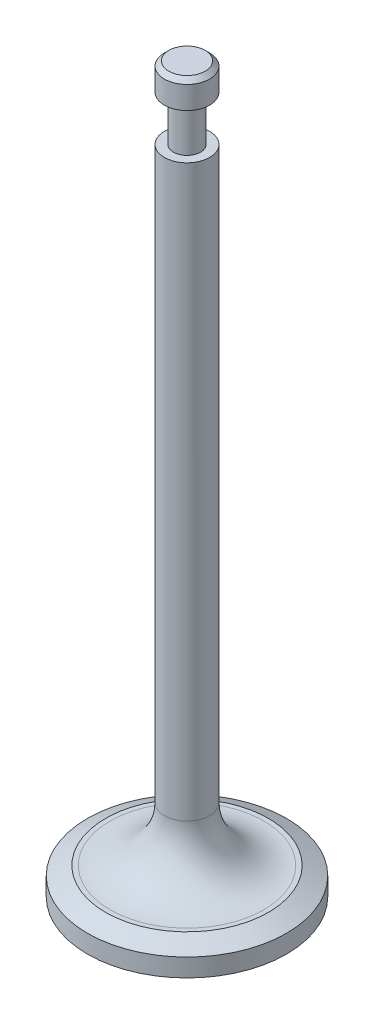
from build123d import *

# Parameters (mm, degrees)
FILLET1_R      = 6
CHAMFER1_SIZE  = 0.5
CHAMFER2_SIZE  = 2
CHAMFER2_SIZE2 = 1


with BuildPart() as part:
    # Sketch2 → Revolve1 (revolve)
    with BuildSketch(Plane.XY):
        Polygon((0, 0), (0, 80), (2.5, 80), (2.5, 77), (1.5, 77), (1.5, 72), (2.5, 72), (2.5, 3), (11, 3), (11, 0), align=None)
    revolve(axis=Axis((0, 0, 0), (0, 1, 0)))

    # Fillet1
    fillet1_edges = [part.edges().sort_by_distance(p)[0] for p in [
        (-2.5, 3, 0),
    ]]
    fillet(fillet1_edges, radius=FILLET1_R)

    # Chamfer1
    chamfer1_edges = [part.edges().sort_by_distance(p)[0] for p in [
        (-2.5, 80, 0),
    ]]
    chamfer(chamfer1_edges, length=CHAMFER1_SIZE)

    # Chamfer2
    chamfer2_edges = [part.edges().sort_by_distance(p)[0] for p in [
        (-11, 3, 0),
    ]]
    chamfer2_side = [part.faces().sort_by_distance(p)[0] for p in [
        (-8.811126984, 3, 0),
    ]]
    chamfer(chamfer2_edges, length=CHAMFER2_SIZE, length2=CHAMFER2_SIZE2, reference=chamfer2_side[0])


solid = part.part
